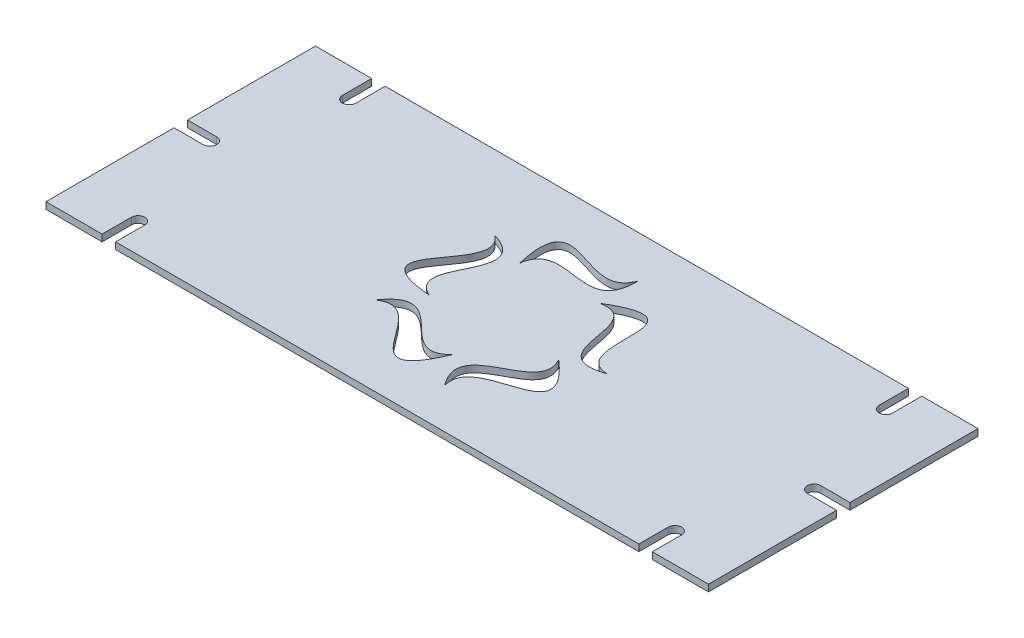
from build123d import *

# Parameters (mm, degrees)
SKETCH1_W           = 295
SKETCH1_H           = 120
BOSS_EXTRUDE1_DEPTH = 3
CUT_EXTRUDE1_DEPTH  = 10
CUT_EXTRUDE3_DEPTH  = 10


with BuildPart() as part:
    # Sketch1 → Boss-Extrude1 (new body)
    with BuildSketch(Plane(origin=(0, 0, 0), x_dir=(1, 0, 0), z_dir=(0, 1, 0))):
        Rectangle(SKETCH1_W, SKETCH1_H)
    extrude(amount=BOSS_EXTRUDE1_DEPTH)

    # Sketch2 → Cut-Extrude1 (cut)
    with BuildSketch(Plane(origin=(0, 3, 0), x_dir=(1, 0, 0), z_dir=(0, 1, 0))):
        with BuildLine():
            Line((-122.5, 60), (-122.5, 47))
            ThreePointArc((-122.5, 47), (-119.5, 44), (-116.5, 47))
            Line((-116.5, 47), (-116.5, 60))
            Line((-116.5, 60), (-122.5, 60))
        make_face()
        with BuildLine():
            Line((116.5, 60), (122.5, 60))
            Line((122.5, 60), (122.5, 47))
            ThreePointArc((122.5, 47), (119.5, 44), (116.5, 47))
            Line((116.5, 47), (116.5, 60))
        make_face()
        with BuildLine():
            Line((122.5, -60), (122.5, -47))
            ThreePointArc((122.5, -47), (119.5, -44), (116.5, -47))
            Line((116.5, -47), (116.5, -60))
            Line((116.5, -60), (122.5, -60))
        make_face()
        with BuildLine():
            Line((-116.5, -60), (-122.5, -60))
            Line((-122.5, -60), (-122.5, -47))
            ThreePointArc((-122.5, -47), (-119.5, -44), (-116.5, -47))
            Line((-116.5, -47), (-116.5, -60))
        make_face()
        with BuildLine():
            Line((147.5, 3), (134.5, 3))
            ThreePointArc((134.5, 3), (131.5, 0), (134.5, -3))
            Line((134.5, -3), (147.5, -3))
            Line((147.5, -3), (147.5, 3))
        make_face()
        with BuildLine():
            Line((-147.5, -3), (-147.5, 3))
            Line((-147.5, 3), (-134.5, 3))
            ThreePointArc((-134.5, 3), (-131.5, 0), (-134.5, -3))
            Line((-134.5, -3), (-147.5, -3))
        make_face()
    extrude(amount=-CUT_EXTRUDE1_DEPTH, mode=Mode.SUBTRACT)

    # Sketch3 → Cut-Extrude3 (cut)
    with BuildSketch(Plane(origin=(0, 3, 0), x_dir=(1, 0, 0), z_dir=(0, 1, 0))):
        with BuildLine():
            add(Edge.make_bspline(
                [(14.959872203, 24.119092629), (49.586304502, 45.000520081), (22.761221317, -0.907514255), (43.839987131, -1.436077044)],
                knots=[0, 0, 0, 0, 1, 1, 1, 1], degree=3))
            add(Edge.make_bspline(
                [(43.839987131, -1.436077044), (18.455024461, -10.312187683), (35.053473034, 27.962728926), (14.959872203, 24.119092629)],
                knots=[0, 0, 0, 0, 1, 1, 1, 1], degree=3))
        make_face()
        with BuildLine():
            add(Edge.make_bspline(
                [(12.181510626, -42.138077647), (-4.104557104, -20.738412515), (37.426254438, -24.696875501), (27.561474957, -6.774474431)],
                knots=[0, 0, 0, 0, 1, 1, 1, 1], degree=3))
            add(Edge.make_bspline(
                [(27.561474957, -6.774474431), (58.121048639, -33.253452555), (6.170506854, -21.92764518), (12.181510626, -42.138077647)],
                knots=[0, 0, 0, 0, 1, 1, 1, 1], degree=3))
        make_face()
        with BuildLine():
            add(Edge.make_bspline(
                [(-36.31139953, -24.606687162), (-20.99178026, -2.504856124), (-11.92277572, -43.226237402), (2.0740561, -28.305948083)],
                knots=[0, 0, 0, 0, 1, 1, 1, 1], degree=3))
            add(Edge.make_bspline(
                [(2.0740561, -28.305948083), (-13.665520982, -65.552284003), (-18.947638353, -12.64451576), (-36.31139953, -24.606687162)],
                knots=[0, 0, 0, 0, 1, 1, 1, 1], degree=3))
        make_face()
        with BuildLine():
            add(Edge.make_bspline(
                [(-34.623189715, 26.930308631), (-8.869076581, 19.190326294), (-44.794935073, -2.018408419), (-26.279637792, -10.719563569)],
                knots=[0, 0, 0, 0, 1, 1, 1, 1], degree=3))
            add(Edge.make_bspline(
                [(-26.279637792, -10.719563569), (-66.56680508, -7.260086999), (-17.880791363, 14.112904669), (-34.623189715, 26.930308631)],
                knots=[0, 0, 0, 0, 1, 1, 1, 1], degree=3))
        make_face()
        with BuildLine():
            add(Edge.make_bspline(
                [(14.913091488, 41.250533224), (15.510389484, 14.365130029), (-15.762016679, 41.978792395), (-18.315765468, 21.680893453)],
                knots=[0, 0, 0, 0, 1, 1, 1, 1], degree=3))
            add(Edge.make_bspline(
                [(-18.315765468, 21.680893453), (-27.47502708, 61.065303477), (7.896701545, 21.366770525), (14.913091488, 41.250533224)],
                knots=[0, 0, 0, 0, 1, 1, 1, 1], degree=3))
        make_face()
    extrude(amount=-CUT_EXTRUDE3_DEPTH, mode=Mode.SUBTRACT)


solid = part.part
